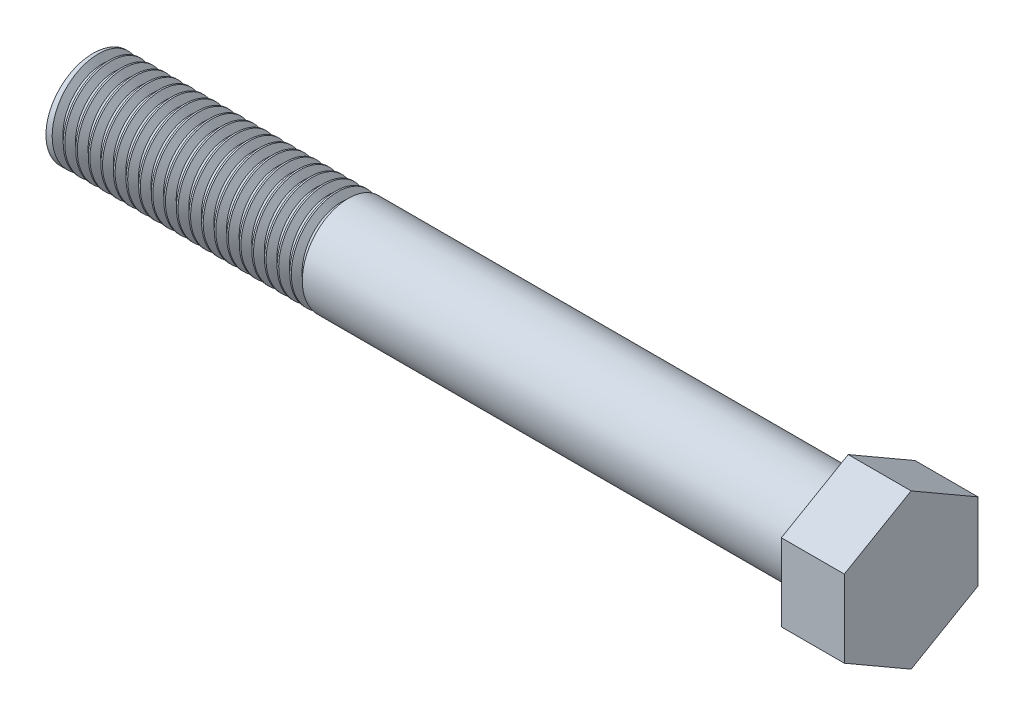
from build123d import *

# Parameters (mm, degrees)
BOSS_EXTRUDE1_DEPTH = 12.7
SKETCH2_R           = 9.525
BOSS_EXTRUDE2_DEPTH = 152.4
THREAD1_PITCH       = 2.54


with BuildPart() as part:
    # Sketch1 → Boss-Extrude1 (new body)
    with BuildSketch(Plane(origin=(0, 0, 0), x_dir=(0, 0, -1), z_dir=(1, 0, 0))):
        Polygon((-13.49375, 7.790620195), (-13.49375, -7.790620195), (0, -15.58124039), (13.49375, -7.790620195), (13.49375, 7.790620195), (0, 15.58124039), align=None)
    extrude(amount=BOSS_EXTRUDE1_DEPTH)

    # Sketch2 → Boss-Extrude2 (add)
    with BuildSketch(Plane.ZY):
        with Locations(Location((0, 0, 0), (0, 0, 180))):
            Circle(SKETCH2_R)
    extrude(amount=BOSS_EXTRUDE2_DEPTH)

    # Thread1: the profile of Thread Profile1 profile screwed along a right-hand helix of 20 turns, 10 arcs to a turn; built about Z, then put on its axis
    thread1_z = Axis((0, 0, 0), (0, 0, 1))
    thread1_corners = [(9.5253, 0, -0.000173205), (9.5253, 0, 2.222673198), (8.150184678, 0, 1.428749997), (8.150184678, 0, 0.793749997)]
    with BuildLine(mode=Mode.PRIVATE) as thread1_profile:
        Line(thread1_corners[0], thread1_corners[1])
        Line(thread1_corners[1], thread1_corners[2])
        Line(thread1_corners[2], thread1_corners[3])
        Line(thread1_corners[3], thread1_corners[0])
    thread1_cap = Face(thread1_profile.wire())
    thread1_turn_angles = [0, 18, 36, 54, 72, 90, 108, 126, 144, 162, 180, 198, 216, 234, 252, 270, 288, 306, 324, 342, 360]
    thread1_turn_weights = [1, 0.9510565162951535, 1, 0.9510565162951535, 1, 0.9510565162951535, 1, 0.9510565162951535, 1, 0.9510565162951535, 1, 0.9510565162951535, 1, 0.9510565162951535, 1, 0.9510565162951535, 1, 0.9510565162951535, 1, 0.9510565162951535, 1]
    thread1_turn_rails = [Edge.make_bspline([Vector(p[0], p[1], 0).rotate(thread1_z, thread1_turn_angles[k]) / thread1_turn_weights[k] + Vector(0, 0, p[2] + THREAD1_PITCH * thread1_turn_angles[k] / 360) for k in range(21)], [0, 0, 0, 1, 1, 2, 2, 3, 3, 4, 4, 5, 5, 6, 6, 7, 7, 8, 8, 9, 9, 10, 10, 10], 2, thread1_turn_weights) for p in thread1_corners]
    thread1_turn_sides = [Face.make_surface_from_curves(thread1_turn_rails[p[0]], thread1_turn_rails[p[1]]) for p in [(0, 1), (1, 2), (2, 3), (3, 0)]]
    thread1 = Plane(origin=(-152.4, 0, 0), x_dir=(0, 0, -1), z_dir=(1, 0, 0)) * Solid(Shell([*[p.moved(Location((0, 0, THREAD1_PITCH * i))) for i in range(20) for p in thread1_turn_sides], thread1_cap, thread1_cap.rotate(thread1_z, 7200).moved(Location((0, 0, THREAD1_PITCH * 7200 / 360)))]))
    add(thread1, mode=Mode.SUBTRACT)


solid = part.part
